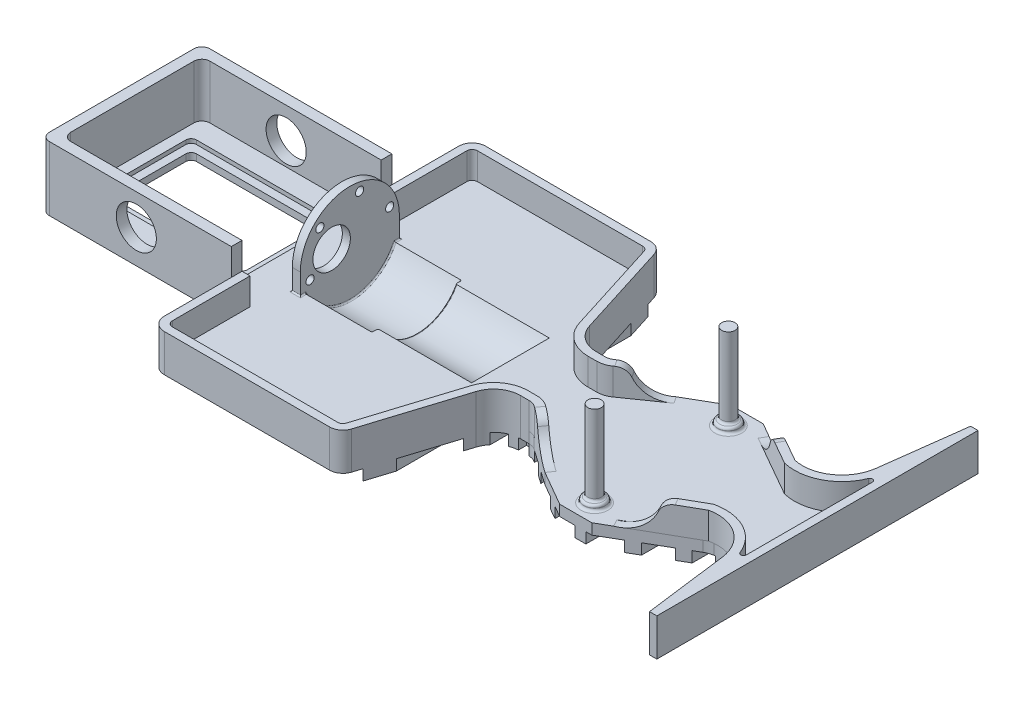
from build123d import *

# Parameters (mm, degrees)
SALIENTE_EXTRUIR2_DEPTH  = 4
REDONDEO2_R              = 5
REDONDEO3_R              = 5
REDONDEO4_R              = 5
CROQUIS8_R               = 4
SALIENTE_EXTRUIR4_DEPTH  = 2
REDONDEO5_R              = 1
CROQUIS9_R               = 2.5
SALIENTE_EXTRUIR5_DEPTH  = 30
REDONDEO6_R              = 1
REDONDEO16_R             = 1
REDONDEO17_R             = 1
CROQUIS38_W              = 55
CROQUIS38_H              = 36
CORTAR_EXTRUIR13_DEPTH   = 1.5
CROQUIS39_W              = 49
CROQUIS39_H              = 30
CORTAR_EXTRUIR14_DEPTH   = 3.5
REDONDEO22_R             = 2
CORTAR_EXTRUIR15_DEPTH   = 147.710599481
CORTAR_EXTRUIR16_DEPTH   = 147.710599481
CROQUIS44_W              = 71
CROQUIS44_H              = 5
CORTAR_EXTRUIR17_DEPTH   = 147.710599481
CROQUIS50_W              = 71
CROQUIS50_H              = 4
SALIENTE_EXTRUIR16_DEPTH = 20
CROQUIS47_R              = 7.5
CORTAR_EXTRUIR20_DEPTH   = 163.160414405
SALIENTE_EXTRUIR18_START = -80
SALIENTE_EXTRUIR18_DEPTH = 60
CORTAR_EXTRUIR34_START   = -80
CORTAR_EXTRUIR34_DEPTH   = 60
SALIENTE_EXTRUIR19_DEPTH = 2
SALIENTE_EXTRUIR20_START = 2
SALIENTE_EXTRUIR20_DEPTH = 2
SALIENTE_EXTRUIR21_START = -80
SALIENTE_EXTRUIR21_DEPTH = 3
CROQUIS90_R              = 1.525
CROQUIS90_R_2            = 7
CORTAR_EXTRUIR35_DEPTH   = 3
CROQUIS78_W              = 4
CROQUIS78_H              = 52
SALIENTE_EXTRUIR22_DEPTH = 20
REDONDEO30_R             = 3
REDONDEO31_R             = 0.5
REDONDEO32_R             = 0.5
SALIENTE_EXTRUIR25_START = -105
SALIENTE_EXTRUIR25_DEPTH = 35
REDONDEO33_R             = 0.5
REDONDEO34_R             = 0.5
CORTAR_EXTRUIR36_DEPTH   = 4
REDONDEO35_R             = 10
REDONDEO36_R             = 5
REDONDEO37_START         = -1
REDONDEO37_DEPTH         = 6
REDONDEO38_R             = 5
SALIENTE_EXTRUIR26_DEPTH = 10
CORTAR_EXTRUIR37_DEPTH   = 147.71059961
SALIENTE_EXTRUIR27_DEPTH = 10
REDONDEO39_R             = 1
CORTAR_EXTRUIR38_START   = -3
CORTAR_EXTRUIR38_DEPTH   = 3
CORTAR_EXTRUIR39_DEPTH   = 3
CORTAR_EXTRUIR40_DEPTH   = 3
CORTAR_EXTRUIR41_DEPTH   = 3
REDONDEO40_R             = 5
SALIENTE_EXTRUIR28_START = 4
CROQUIS102_W             = 4
CROQUIS102_H             = 12.86120104
CROQUIS102_W_2           = 6
CROQUIS102_W_3           = 8
CROQUIS102_W_4           = 10
CROQUIS102_W_5           = 5
SALIENTE_EXTRUIR28_DEPTH = 4


with BuildPart() as part:
    # Croquis3 → Saliente-Extruir2 (new body)
    with BuildSketch(Plane(origin=(0, 0, 0), x_dir=(1, 0, 0), z_dir=(0, 1, 0))):
        Polygon((-59, -35), (-59, -60), (18.970588235, -60), (44.143577171, -30), (54.143577171, -30), (66.730071638, -45), (76.730071638, -45), (89.316566106, -30), (99.316566106, -30), (124.489555041, -60), (130, -60), (130, 60), (126.176470588, 60), (124.489555041, 60), (99.316566106, 30), (89.316566106, 30), (76.730071638, 45), (66.730071638, 45), (54.143577171, 30), (44.143577171, 30), (18.970588235, 60), (-59, 60), (-59, 35), (-130, 35), (-130, -35), align=None)
    extrude(amount=SALIENTE_EXTRUIR2_DEPTH)

    # Redondeo2
    redondeo2_edges = [part.edges().sort_by_distance(p)[0] for p in [
        (44.143577171, 2, -30),
        (54.143577171, 2, -30),
        (66.730071638, 2, -45),
        (76.730071638, 2, -45),
        (89.316566106, 2, -30),
        (99.316566106, 2, -30),
    ]]
    fillet(redondeo2_edges, radius=REDONDEO2_R)

    # Redondeo3
    redondeo3_edges = [part.edges().sort_by_distance(p)[0] for p in [
        (99.316566106, 2, 30),
        (89.316566106, 2, 30),
        (76.730071638, 2, 45),
        (66.730071638, 2, 45),
        (54.143577171, 2, 30),
        (44.143577171, 2, 30),
    ]]
    fillet(redondeo3_edges, radius=REDONDEO3_R)

    # Redondeo4
    redondeo4_edges = [part.edges().sort_by_distance(p)[0] for p in [
        (-59, 2, 60),
        (-59, 2, -60),
        (18.970588235, 2, -60),
        (18.970588235, 2, 60),
    ]]
    fillet(redondeo4_edges, radius=REDONDEO4_R)

    # Croquis8 → Saliente-Extruir4 (add)
    with BuildSketch(Plane(origin=(0, 4, 0), x_dir=(1, 0, 0), z_dir=(0, 1, 0))):
        with Locations(Location((71.730071638, 25, 0), (0, 0, 270))):
            Circle(CROQUIS8_R)
        with Locations(Location((71.730071638, -25, 0), (0, 0, 90))):
            Circle(CROQUIS8_R)
    extrude(amount=SALIENTE_EXTRUIR4_DEPTH)

    # Redondeo5
    redondeo5_edges = [part.edges().sort_by_distance(p)[0] for p in [
        (71.730071638, 4, -29),
        (71.730071638, 4, 29),
    ]]
    fillet(redondeo5_edges, radius=REDONDEO5_R)

    # Croquis9 → Saliente-Extruir5 (add)
    with BuildSketch(Plane(origin=(0, 6, 0), x_dir=(1, 0, 0), z_dir=(0, 1, 0))):
        with Locations(Location((71.730071638, 25, 0), (0, 0, 270))):
            Circle(CROQUIS9_R)
        with Locations(Location((71.730071638, -25, 0), (0, 0, 90))):
            Circle(CROQUIS9_R)
    extrude(amount=SALIENTE_EXTRUIR5_DEPTH)

    # Redondeo6
    redondeo6_edges = [part.edges().sort_by_distance(p)[0] for p in [
        (71.730071638, 6, -27.5),
        (71.730071638, 6, 27.5),
    ]]
    fillet(redondeo6_edges, radius=REDONDEO6_R)

    # Redondeo16
    redondeo16_edges = [part.edges().sort_by_distance(p)[0] for p in [
        (71.730071638, 6, 29),
    ]]
    fillet(redondeo16_edges, radius=REDONDEO16_R)

    # Redondeo17
    redondeo17_edges = [part.edges().sort_by_distance(p)[0] for p in [
        (71.730071638, 6, -29),
    ]]
    fillet(redondeo17_edges, radius=REDONDEO17_R)

    # Croquis38 → Cortar-Extruir13 (cut)
    with BuildSketch(Plane(origin=(0, 4, 0), x_dir=(1, 0, 0), z_dir=(0, 1, 0))):
        with Locations((-94.5, 0)):
            Rectangle(CROQUIS38_W, CROQUIS38_H)
    extrude(amount=-CORTAR_EXTRUIR13_DEPTH, mode=Mode.SUBTRACT)

    # Croquis39 → Cortar-Extruir14 (cut)
    with BuildSketch(Plane(origin=(0, 2.5, 0), x_dir=(1, 0, 0), z_dir=(0, 1, 0))):
        with Locations((-94.5, 0)):
            Rectangle(CROQUIS39_W, CROQUIS39_H)
    extrude(amount=-CORTAR_EXTRUIR14_DEPTH, mode=Mode.SUBTRACT)

    # Redondeo22
    redondeo22_edges = [part.edges().sort_by_distance(p)[0] for p in [
        (-67, 3.25, -18),
        (-67, 3.25, 18),
        (-122, 3.25, 18),
        (-122, 3.25, -18),
        (-119, 1.25, -15),
        (-70, 1.25, -15),
        (-70, 1.25, 15),
        (-119, 1.25, 15),
    ]]
    fillet(redondeo22_edges, radius=REDONDEO22_R)

    # Croquis41 → Cortar-Extruir15 (cut, through all)
    with BuildSketch(Plane(origin=(0, 4, 0), x_dir=(1, 0, 0), z_dir=(0, 1, 0))):
        Polygon((36.709615378, -24.497241674), (52.709615378, -24.497241674), (65.730071638, -32.0146056), (77.730071638, -32.0146056), (89.879724933, -25), (105.879724933, -25), (124.489555041, -60), (17.988730662, -59.706105014), align=None)
        Polygon((89.879724933, 25), (105.879724933, 25), (124.489555041, 60), (17.988730662, 59.706105014), (36.709615378, 24.497241674), (52.709615378, 24.497241674), (65.730071638, 32.0146056), (77.730071638, 32.0146056), align=None)
    extrude(amount=-CORTAR_EXTRUIR15_DEPTH, mode=Mode.SUBTRACT)

    # Croquis42 → Cortar-Extruir16 (cut, through all)
    with BuildSketch(Plane(origin=(0, 4, 0), x_dir=(1, 0, 0), z_dir=(0, 1, 0))):
        Polygon((36.709615378, -24.497241674), (11.382827369, -60), (16.639049945, -60), (18.382827369, -60), align=None)
        Polygon((18.382827369, 60), (16.639049945, 60), (11.382827369, 60), (36.709615378, 24.497241674), align=None)
        Polygon((105.879724933, 25), (111.750596842, 25), (124.489555041, 60), align=None)
        Polygon((124.489555041, -60), (105.879724933, -25), (111.750596842, -25), align=None)
    extrude(amount=-CORTAR_EXTRUIR16_DEPTH, mode=Mode.SUBTRACT)

    # Croquis44 → Cortar-Extruir17 (cut, through all)
    with BuildSketch(Plane(origin=(0, 4, 0), x_dir=(1, 0, 0), z_dir=(0, 1, 0))):
        with Locations((-94.5, 32.5)):
            Rectangle(CROQUIS44_W, CROQUIS44_H)
        with Locations((-94.5, -32.5)):
            Rectangle(CROQUIS44_W, CROQUIS44_H)
    extrude(amount=-CORTAR_EXTRUIR17_DEPTH, mode=Mode.SUBTRACT)

    # Croquis50 → Saliente-Extruir16 (add)
    with BuildSketch(Plane(origin=(0, 4, 0), x_dir=(1, 0, 0), z_dir=(0, 1, 0))):
        with Locations((-94.5, 28)):
            Rectangle(CROQUIS50_W, CROQUIS50_H)
        with Locations((-94.5, -28)):
            Rectangle(CROQUIS50_W, CROQUIS50_H)
    extrude(amount=SALIENTE_EXTRUIR16_DEPTH)

    # Croquis47 → Cortar-Extruir20 (cut, through all)
    with BuildSketch(Plane.XY.offset(30)):
        with Locations((-94.5, 12.5)):
            Circle(CROQUIS47_R)
    extrude(amount=-CORTAR_EXTRUIR20_DEPTH, mode=Mode.SUBTRACT)

    # Croquis85 → Saliente-Extruir18 (add)
    with BuildSketch(Plane.ZY.offset(130).offset(SALIENTE_EXTRUIR18_START)):
        with BuildLine():
            Line((-19.51, 0), (-23.24, 0))
            ThreePointArc((-23.24, 0), (-5.3, -9.650374415), (12.64, 0))
            Line((12.64, 0), (8.91, 0))
            ThreePointArc((8.91, 0), (-5.3, -6.652610627), (-19.51, 0))
        make_face()
    extrude(amount=-SALIENTE_EXTRUIR18_DEPTH)

    # Croquis86 → Cortar-Extruir34 (cut)
    with BuildSketch(Plane.ZY.offset(130).offset(CORTAR_EXTRUIR34_START)):
        with BuildLine():
            Line((-22.054823186, 4), (11.454823186, 4))
            ThreePointArc((11.454823186, 4), (-5.3, -6.652610627), (-22.054823186, 4))
        make_face()
    extrude(amount=-CORTAR_EXTRUIR34_DEPTH, mode=Mode.SUBTRACT)

    # Croquis87 → Saliente-Extruir19 (add)
    with BuildSketch(Plane(origin=(10, 0, 0), x_dir=(0, 0, -1), z_dir=(1, 0, 0))):
        with BuildLine():
            Line((-8.91, 0), (-12.64, 0))
            ThreePointArc((-12.64, 0), (5.3, -9.650374415), (23.24, 0))
            Line((23.24, 0), (19.51, 0))
            Line((19.51, 0), (-8.91, 0))
        make_face()
    extrude(amount=SALIENTE_EXTRUIR19_DEPTH)

    # Croquis88 → Saliente-Extruir20 (add)
    with BuildSketch(Plane.ZY.offset(50).offset(SALIENTE_EXTRUIR20_START)):
        with BuildLine():
            Line((-23.24, 0), (12.64, 0))
            ThreePointArc((12.64, 0), (-5.3, -9.650374415), (-23.24, 0))
        make_face()
    extrude(amount=-SALIENTE_EXTRUIR20_DEPTH)

    # Saliente-Extruir21: read off the stored shape, not the designer's step
    # Saliente-Extruir21 outline → Saliente-Extruir21 (add)
    with BuildSketch(Plane.ZY.offset(130).offset(SALIENTE_EXTRUIR21_START)):
        with BuildLine():
            Line((-23.8, 4), (13.2, 4))
            Line((13.2, 4), (13.2, 11.85))
            ThreePointArc((13.2, 11.85), (-5.3, 30.35), (-23.8, 11.85))
            Line((-23.8, 11.85), (-23.8, 4))
        make_face()
    extrude(amount=SALIENTE_EXTRUIR21_DEPTH)

    # Croquis90 → Cortar-Extruir35 (cut)
    with BuildSketch(Plane.ZY.offset(53)):
        with Locations((9.572370307, 7.483926082)):
            Circle(CROQUIS90_R)
        with Locations((5.917316081, 22.546813541)):
            Circle(CROQUIS90_R)
        with Locations((-20.172370307, 16.216073918)):
            Circle(CROQUIS90_R)
        with Locations((-8.955054226, 26.912887459)):
            Circle(CROQUIS90_R)
        with Locations((1.502594336, 13.500748683)):
            Circle(CROQUIS90_R_2)
    extrude(amount=-CORTAR_EXTRUIR35_DEPTH, mode=Mode.SUBTRACT)

    # Croquis78 → Saliente-Extruir22 (add)
    with BuildSketch(Plane(origin=(0, 4, 0), x_dir=(1, 0, 0), z_dir=(0, 1, 0))):
        with Locations((-128, 0)):
            Rectangle(CROQUIS78_W, CROQUIS78_H)
    extrude(amount=SALIENTE_EXTRUIR22_DEPTH)

    # Redondeo30
    redondeo30_edges = [part.edges().sort_by_distance(p)[0] for p in [
        (-130, 12, -30),
        (-130, 12, 30),
        (-126, 14, -26),
        (-126, 14, 26),
    ]]
    fillet(redondeo30_edges, radius=REDONDEO30_R)

    # Redondeo31
    redondeo31_edges = [part.edges().sort_by_distance(p)[0] for p in [
        (-20, 0, -23.24),
        (-20, 0, 12.64),
        (12, 0, -5.3),
        (-52, 0, -5.3),
    ]]
    fillet(redondeo31_edges, radius=REDONDEO31_R)

    # Redondeo32
    redondeo32_edges = [part.edges().sort_by_distance(p)[0] for p in [
        (-50, -6.652610627, -5.3),
        (-53, 4, -5.3),
        (-51.5, 4, -23.8),
        (-51.5, 4, 13.2),
        (-50, 4, 12.327411593),
        (-50, 4, -22.927411593),
    ]]
    fillet(redondeo32_edges, radius=REDONDEO32_R)

    # Croquis91 → Saliente-Extruir25 (add)
    with BuildSketch(Plane.ZY.offset(130).offset(SALIENTE_EXTRUIR25_START)):
        with BuildLine():
            Line((-25.316083533, 4), (-19.813011398, 4))
            ThreePointArc((-19.813011398, 4), (-5.3, -4.649999995), (9.213011398, 4))
            Line((9.213011398, 4), (14.716083533, 4))
            ThreePointArc((14.716083533, 4), (-5.3, -9.650374415), (-25.316083533, 4))
        make_face()
    extrude(amount=-SALIENTE_EXTRUIR25_DEPTH)

    # Redondeo33
    redondeo33_edges = [part.edges().sort_by_distance(p)[0] for p in [
        (-25, -6.652610627, -5.3),
    ]]
    fillet(redondeo33_edges, radius=REDONDEO33_R)

    # Redondeo34
    redondeo34_edges = [part.edges().sort_by_distance(p)[0] for p in [
        (-25, -4.649999995, -5.3),
    ]]
    fillet(redondeo34_edges, radius=REDONDEO34_R)

    # Croquis94 → Cortar-Extruir36 (cut)
    with BuildSketch(Plane(origin=(0, 4, 0), x_dir=(1, 0, 0), z_dir=(0, 1, 0))):
        Polygon((36.709615378, -24.497241674), (11.382827369, -60), (25.834810501, -14.172865819), (37.964878581, -14.172865819), (52.709615378, -24.497241674), align=None)
        Polygon((36.709615378, 24.497241674), (11.382827369, 60), (25.834810501, 14.172865819), (37.964878581, 14.172865819), (52.709615378, 24.497241674), align=None)
    extrude(amount=-CORTAR_EXTRUIR36_DEPTH, mode=Mode.SUBTRACT)

    # Redondeo35
    redondeo35_edges = [part.edges().sort_by_distance(p)[0] for p in [
        (25.834810501, 2, 14.172865819),
        (25.834810501, 2, -14.172865819),
    ]]
    fillet(redondeo35_edges, radius=REDONDEO35_R)

    # Redondeo36
    redondeo36_edges = [part.edges().sort_by_distance(p)[0] for p in [
        (37.964878581, 2, 14.172865819),
        (37.964878581, 2, -14.172865819),
    ]]
    fillet(redondeo36_edges, radius=REDONDEO36_R)

    # Redondeo37: read off the stored shape, not the designer's step
    # Redondeo37 outline → Redondeo37 (cut)
    with BuildSketch(Plane(origin=(0, 0, 0), x_dir=(1, 0, 0), z_dir=(0, 1, 0)).offset(REDONDEO37_START)):
        with BuildLine():
            Line((52.709615378, -24.497241674), (52.728521121, -24.508156909))
            ThreePointArc((52.728521121, -24.508156909), (52.709871317, -24.49683993), (52.691732903, -24.48472023))
            Line((52.691732903, -24.48472023), (52.709615378, -24.497241674))
        make_face()
        with BuildLine():
            ThreePointArc((52.691732903, 24.48472023), (52.709871317, 24.49683993), (52.728521121, 24.508156909))
            Line((52.728521121, 24.508156909), (52.709615378, 24.497241674))
            Line((52.709615378, 24.497241674), (52.691732903, 24.48472023))
        make_face()
    extrude(amount=REDONDEO37_DEPTH, mode=Mode.SUBTRACT)

    # Redondeo38
    redondeo38_edges = [part.edges().sort_by_distance(p)[0] for p in [
        (11.382827369, 2, -60),
        (11.382827369, 2, 60),
    ]]
    fillet(redondeo38_edges, radius=REDONDEO38_R)

    # Croquis95 → Saliente-Extruir26 (add)
    with BuildSketch(Plane(origin=(0, 4, 0), x_dir=(1, 0, 0), z_dir=(0, 1, 0))):
        with BuildLine():
            Line((-59, 55), (-59, 26))
            Line((-59, 26), (-56, 26))
            Line((-56, 26), (-56, 55))
            ThreePointArc((-56, 55), (-55.414213562, 56.414213562), (-54, 57))
            Line((-54, 57), (7.71688498, 57))
            ThreePointArc((7.71688498, 57), (8.899460368, 56.612921403), (9.624286134, 55.601515451))
            Line((9.624286134, 55.601515451), (20.768587779, 20.263015386))
            ThreePointArc((20.768587779, 20.263015386), (25.479955256, 13.688876702), (33.166695279, 11.172865819))
            Line((33.166695279, 11.172865819), (36.388384637, 11.172865819))
            ThreePointArc((36.388384637, 11.172865819), (38.794031033, 11.543130213), (40.976996128, 12.619649465))
            Line((40.976996128, 12.619649465), (54.412462212, 22.027264097))
            Line((54.412462212, 22.027264097), (52.691732903, 24.48472023))
            Line((52.691732903, 24.48472023), (39.256266819, 15.077105598))
            ThreePointArc((39.256266819, 15.077105598), (37.891913634, 14.404281066), (36.388384637, 14.172865819))
            Line((36.388384637, 14.172865819), (33.166695279, 14.172865819))
            ThreePointArc((33.166695279, 14.172865819), (27.253818339, 16.108258806), (23.62968951, 21.165288563))
            Line((23.62968951, 21.165288563), (12.485387865, 56.503788628))
            ThreePointArc((12.485387865, 56.503788628), (10.67332345, 59.032303507), (7.71688498, 60))
            Line((7.71688498, 60), (-54, 60))
            ThreePointArc((-54, 60), (-57.535533906, 58.535533906), (-59, 55))
        make_face()
        with BuildLine():
            Line((20.768587779, -20.263015386), (9.624286134, -55.601515451))
            ThreePointArc((9.624286134, -55.601515451), (8.899460368, -56.612921403), (7.71688498, -57))
            Line((7.71688498, -57), (-54, -57))
            ThreePointArc((-54, -57), (-55.414213562, -56.414213562), (-56, -55))
            Line((-56, -55), (-56, -26))
            Line((-56, -26), (-59, -26))
            Line((-59, -26), (-59, -55))
            ThreePointArc((-59, -55), (-57.535533906, -58.535533906), (-54, -60))
            Line((-54, -60), (7.71688498, -60))
            ThreePointArc((7.71688498, -60), (10.67332345, -59.032303507), (12.485387865, -56.503788628))
            Line((12.485387865, -56.503788628), (23.62968951, -21.165288563))
            ThreePointArc((23.62968951, -21.165288563), (27.253818339, -16.108258806), (33.166695279, -14.172865819))
            Line((33.166695279, -14.172865819), (36.388384637, -14.172865819))
            ThreePointArc((36.388384637, -14.172865819), (38.069372802, -14.460165601), (39.559524375, -15.289448825))
            Line((39.559524375, -15.289448825), (52.691732903, -24.48472023))
            Line((52.691732903, -24.48472023), (54.412462212, -22.027264097))
            Line((54.412462212, -22.027264097), (41.352231728, -12.882392261))
            ThreePointArc((41.352231728, -12.882392261), (39.013373142, -11.612220092), (36.388384637, -11.172865819))
            Line((36.388384637, -11.172865819), (33.166695279, -11.172865819))
            ThreePointArc((33.166695279, -11.172865819), (25.479955256, -13.688876702), (20.768587779, -20.263015386))
        make_face()
    extrude(amount=SALIENTE_EXTRUIR26_DEPTH)

    # Croquis96 → Cortar-Extruir37 (cut, through all)
    with BuildSketch(Plane(origin=(0, 4, 0), x_dir=(1, 0, 0), z_dir=(0, 1, 0))):
        with BuildLine():
            Line((123.217586943, 28.695574447), (127.244777521, 60))
            Line((127.244777521, 60), (124.489555041, 60))
            Line((124.489555041, 60), (111.750596842, 25))
            Line((111.750596842, 25), (89.879724933, 25))
            Line((89.879724933, 25), (104.038524356, 16.825413342))
            ThreePointArc((104.038524356, 16.825413342), (105.493747267, 16.135022728), (107.040932788, 15.687217098))
            ThreePointArc((107.040932788, 15.687217098), (117.748216056, 18.934570379), (123.217586943, 28.695574447))
        make_face()
        with BuildLine():
            Line((111.750596842, -25), (124.489555041, -60))
            Line((124.489555041, -60), (127.244777521, -60))
            Line((127.244777521, -60), (123.217586943, -28.695574447))
            ThreePointArc((123.217586943, -28.695574447), (117.748216056, -18.934570379), (107.040932788, -15.687217098))
            ThreePointArc((107.040932788, -15.687217098), (105.493747267, -16.135022728), (104.038524356, -16.825413342))
            Line((104.038524356, -16.825413342), (89.879724933, -25))
            Line((89.879724933, -25), (111.750596842, -25))
        make_face()
    extrude(amount=-CORTAR_EXTRUIR37_DEPTH, mode=Mode.SUBTRACT)

    # Croquis97 → Saliente-Extruir27 (add)
    with BuildSketch(Plane(origin=(0, 4, 0), x_dir=(1, 0, 0), z_dir=(0, 1, 0))):
        with BuildLine():
            Line((104.393126751, -13.308973374), (81.448302044, -26.403825859))
            Line((81.448302044, -26.403825859), (82.935308233, -29.009360851))
            Line((82.935308233, -29.009360851), (105.493747267, -16.135022728))
            ThreePointArc((105.493747267, -16.135022728), (117.108914841, -18.530268491), (123.217586943, -28.695574447))
            Line((123.217586943, -28.695574447), (127.244777521, -60))
            Line((127.244777521, -60), (130, -60))
            Line((130, -60), (130, 0))
            Line((130, 0), (130, 60))
            Line((130, 60), (127.244777521, 60))
            Line((127.244777521, 60), (123.217586943, 28.695574447))
            ThreePointArc((123.217586943, 28.695574447), (117.108914841, 18.530268491), (105.493747267, 16.135022728))
            Line((105.493747267, 16.135022728), (82.935308233, 29.009360851))
            Line((82.935308233, 29.009360851), (81.448302044, 26.403825859))
            Line((81.448302044, 26.403825859), (104.393126751, 13.308973374))
            ThreePointArc((104.393126751, 13.308973374), (118.643496101, 15.942887034), (126.19306618, 28.312790808))
            Line((126.19306618, 28.312790808), (127, 34.585302431))
            Line((127, 34.585302431), (127, 0))
            Line((127, 0), (127, -34.585302431))
            Line((127, -34.585302431), (126.19306618, -28.312790808))
            ThreePointArc((126.19306618, -28.312790808), (118.643496101, -15.942887034), (104.393126751, -13.308973374))
        make_face()
    extrude(amount=SALIENTE_EXTRUIR27_DEPTH)

    # Redondeo39
    redondeo39_edges = [part.edges().sort_by_distance(p)[0] for p in [
        (127, 9, 34.585302431),
        (127, 9, -34.585302431),
    ]]
    fillet(redondeo39_edges, radius=REDONDEO39_R)

    # Croquis98 → Cortar-Extruir38 (cut)
    with BuildSketch(Plane(origin=(32.864525609, 0, 57.585282465), x_dir=(0.8685116638450697, 0, -0.49566872986407845), z_dir=(0.49566872986407845, 0, 0.8685116638450697)).offset(CORTAR_EXTRUIR38_START)):
        with BuildLine():
            Line((57.651249498, 4), (57.651249498, 14))
            Line((57.651249498, 14), (70.63808662, 14))
            ThreePointArc((70.63808662, 14), (66.238795876, 6.280390313), (57.651249498, 4))
        make_face()
    extrude(amount=CORTAR_EXTRUIR38_DEPTH, mode=Mode.SUBTRACT)

    # Croquis99 → Cortar-Extruir39 (cut)
    with BuildSketch(Plane(origin=(5.830993971, 0, -8.327522417), x_dir=(0.8191520442889909, 0, 0.5735764363510474), z_dir=(-0.5735764363510474, 0, 0.8191520442889909))):
        with BuildLine():
            Line((45.097155899, 14), (57.206399299, 14))
            Line((57.206399299, 14), (57.206399299, 4))
            ThreePointArc((57.206399299, 4), (49.179026827, 6.611148073), (45.097155899, 14))
        make_face()
    extrude(amount=-CORTAR_EXTRUIR39_DEPTH, mode=Mode.SUBTRACT)

    # Croquis100 → Cortar-Extruir40 (cut)
    with BuildSketch(Plane(origin=(5.830993971, 0, 8.327522417), x_dir=(-0.8191520442889909, 0, 0.5735764363510474), z_dir=(-0.5735764363510474, 0, -0.8191520442889909))):
        with BuildLine():
            Line((-45.096399299, 14), (-57.206399299, 14))
            Line((-57.206399299, 14), (-57.206399299, 4))
            ThreePointArc((-57.206399299, 4), (-49.178548218, 6.610877341), (-45.096399299, 14))
        make_face()
    extrude(amount=-CORTAR_EXTRUIR40_DEPTH, mode=Mode.SUBTRACT)

    # Croquis101 → Cortar-Extruir41 (cut)
    with BuildSketch(Plane(origin=(32.864525609, 0, -57.585282465), x_dir=(-0.8685116638450697, 0, -0.49566872986407845), z_dir=(0.49566872986407845, 0, -0.8685116638450697))):
        with BuildLine():
            Line((-70.63808662, 14), (-57.651249498, 14))
            Line((-57.651249498, 14), (-57.651249498, 4))
            ThreePointArc((-57.651249498, 4), (-66.238795876, 6.280390313), (-70.63808662, 14))
        make_face()
    extrude(amount=-CORTAR_EXTRUIR41_DEPTH, mode=Mode.SUBTRACT)

    # Redondeo40
    redondeo40_edges = [part.edges().sort_by_distance(p)[0] for p in [
        (93.471024655, 14, 21.269424294),
        (43.632786071, 14, 16.310415487),
        (43.632166301, 14, -16.309981519),
        (93.471024655, 14, -21.269424294),
    ]]
    fillet(redondeo40_edges, radius=REDONDEO40_R)

    # Croquis102 → Saliente-Extruir28 (add)
    with BuildSketch(Plane.XZ.offset(SALIENTE_EXTRUIR28_START)):
        with BuildLine():
            Line((44.5, 18.7488071), (44.5, 11.188845622))
            Line((44.5, 11.188845622), (39.5, 11.188845622))
            Line((39.5, 11.188845622), (39.5, 15.247769409))
            ThreePointArc((39.5, 15.247769409), (38.086558456, 14.469080097), (36.5, 14.174111774))
            Line((36.5, 14.174111774), (36.5, 11.188845622))
            Line((36.5, 11.188845622), (32.5, 11.188845622))
            Line((32.5, 11.188845622), (32.5, 14.1951147))
            ThreePointArc((32.5, 14.1951147), (30.973930393, 14.416238218), (29.5, 14.869353272))
            Line((29.5, 14.869353272), (29.5, 11.188845622))
            Line((29.5, 11.188845622), (25.5, 11.188845622))
            Line((25.5, 11.188845622), (25.5, 17.752446558))
            ThreePointArc((25.5, 17.752446558), (24.397219521, 19.367005343), (23.62968951, 21.165288563))
            Line((23.62968951, 21.165288563), (22.5, 24.747525843))
            Line((22.5, 24.747525843), (22.5, 11.188845622))
            Line((22.5, 11.188845622), (16.5, 11.188845622))
            Line((16.5, 11.188845622), (16.5, 43.773482529))
            Line((16.5, 43.773482529), (13.5, 53.286460872))
            Line((13.5, 53.286460872), (13.5, 11.188845622))
            Line((13.5, 11.188845622), (12.5, 11.188845622))
            Line((12.5, 11.188845622), (12.5, 7.188845622))
            Line((12.5, 7.188845622), (13.5, 7.188845622))
            Line((13.5, 7.188845622), (13.5, -5.672355418))
            Line((13.5, -5.672355418), (12.5, -5.672355418))
            Line((12.5, -5.672355418), (12.5, -9.672355418))
            Line((12.5, -9.672355418), (13.5, -9.672355418))
            Line((13.5, -9.672355418), (13.5, -53.286460872))
            Line((13.5, -53.286460872), (16.5, -43.773482529))
            Line((16.5, -43.773482529), (16.5, -9.672355418))
            Line((16.5, -9.672355418), (22.5, -9.672355418))
            Line((22.5, -9.672355418), (22.5, -24.747525843))
            Line((22.5, -24.747525843), (23.62968951, -21.165288563))
            ThreePointArc((23.62968951, -21.165288563), (24.397219521, -19.367005343), (25.5, -17.752446558))
            Line((25.5, -17.752446558), (25.5, -9.672355418))
            Line((25.5, -9.672355418), (29.5, -9.672355418))
            Line((29.5, -9.672355418), (29.5, -14.869353272))
            ThreePointArc((29.5, -14.869353272), (30.973930393, -14.416238218), (32.5, -14.1951147))
            Line((32.5, -14.1951147), (32.5, -9.672355418))
            Line((32.5, -9.672355418), (36.5, -9.672355418))
            Line((36.5, -9.672355418), (36.5, -14.174111774))
            ThreePointArc((36.5, -14.174111774), (38.088035728, -14.46495232), (39.5, -15.247769409))
            Line((39.5, -15.247769409), (39.5, -9.672355418))
            Line((39.5, -9.672355418), (44.5, -9.672355418))
            Line((44.5, -9.672355418), (44.5, -18.7488071))
            Line((44.5, -18.7488071), (47.5, -20.849429715))
            Line((47.5, -20.849429715), (47.5, -9.672355418))
            Line((47.5, -9.672355418), (57.5, -9.672355418))
            Line((57.5, -9.672355418), (57.5, -27.262971525))
            Line((57.5, -27.262971525), (61.5, -29.572372601))
            Line((61.5, -29.572372601), (61.5, -9.672355418))
            Line((61.5, -9.672355418), (71.5, -9.672355418))
            Line((71.5, -9.672355418), (71.5, -32.0146056))
            Line((71.5, -32.0146056), (75.5, -32.0146056))
            Line((75.5, -32.0146056), (75.5, -9.672355418))
            Line((75.5, -9.672355418), (85.5, -9.672355418))
            Line((85.5, -9.672355418), (85.5, -27.528635369))
            Line((85.5, -27.528635369), (89.5, -25.262822301))
            Line((89.5, -25.262822301), (89.5, -9.672355418))
            Line((89.5, -9.672355418), (97.5, -9.672355418))
            Line((97.5, -9.672355418), (97.5, -20.731196164))
            Line((97.5, -20.731196164), (101.5, -18.465383096))
            Line((101.5, -18.465383096), (101.5, -9.672355418))
            Line((101.5, -9.672355418), (107.5, -9.672355418))
            Line((107.5, -9.672355418), (107.5, -15.653663327))
            ThreePointArc((107.5, -15.653663327), (109.510343282, -15.672901046), (111.5, -15.961200108))
            Line((111.5, -15.961200108), (111.5, -9.672355418))
            Line((111.5, -9.672355418), (115.5, -9.672355418))
            Line((115.5, -9.672355418), (115.5, -17.439014331))
            ThreePointArc((115.5, -17.439014331), (117.638261736, -18.870279647), (119.5, -20.646403035))
            Line((119.5, -20.646403035), (119.5, 20.592454822))
            ThreePointArc((119.5, 20.592454822), (117.635032806, 18.844451425), (115.5, 17.439014331))
            Line((115.5, 17.439014331), (115.5, 11.188845622))
            Line((115.5, 11.188845622), (111.5, 11.188845622))
            Line((111.5, 11.188845622), (111.5, 15.961200108))
            ThreePointArc((111.5, 15.961200108), (109.510343282, 15.672901046), (107.5, 15.653663327))
            Line((107.5, 15.653663327), (107.5, 11.188845622))
            Line((107.5, 11.188845622), (101.5, 11.188845622))
            Line((101.5, 11.188845622), (101.5, 18.291031062))
            Line((101.5, 18.291031062), (97.5, 20.600432139))
            Line((97.5, 20.600432139), (97.5, 11.188845622))
            Line((97.5, 11.188845622), (89.5, 11.188845622))
            Line((89.5, 11.188845622), (89.5, 25.219234292))
            Line((89.5, 25.219234292), (85.5, 27.528635369))
            Line((85.5, 27.528635369), (85.5, 11.188845622))
            Line((85.5, 11.188845622), (75.5, 11.188845622))
            Line((75.5, 11.188845622), (75.5, 32.0146056))
            Line((75.5, 32.0146056), (71.5, 32.0146056))
            Line((71.5, 32.0146056), (71.5, 11.188845622))
            Line((71.5, 11.188845622), (61.5, 11.188845622))
            Line((61.5, 11.188845622), (61.5, 29.572372601))
            Line((61.5, 29.572372601), (57.5, 27.262971525))
            Line((57.5, 27.262971525), (57.5, 11.188845622))
            Line((57.5, 11.188845622), (47.5, 11.188845622))
            Line((47.5, 11.188845622), (47.5, 20.849429715))
            Line((47.5, 20.849429715), (44.5, 18.7488071))
        make_face()
        with Locations((113.5, 0.758245102)):
            Rectangle(CROQUIS102_W, CROQUIS102_H, mode=Mode.SUBTRACT)
        with Locations((104.5, 0.758245102)):
            Rectangle(CROQUIS102_W_2, CROQUIS102_H, mode=Mode.SUBTRACT)
        with Locations((93.5, 0.758245102)):
            Rectangle(CROQUIS102_W_3, CROQUIS102_H, mode=Mode.SUBTRACT)
        with Locations((80.5, 0.758245102)):
            Rectangle(CROQUIS102_W_4, CROQUIS102_H, mode=Mode.SUBTRACT)
        with Locations((66.5, 0.758245102)):
            Rectangle(CROQUIS102_W_4, CROQUIS102_H, mode=Mode.SUBTRACT)
        with Locations((52.5, 0.758245102)):
            Rectangle(CROQUIS102_W_4, CROQUIS102_H, mode=Mode.SUBTRACT)
        with Locations((42, 0.758245102)):
            Rectangle(CROQUIS102_W_5, CROQUIS102_H, mode=Mode.SUBTRACT)
        with Locations((27.5, 0.758245102)):
            Rectangle(CROQUIS102_W, CROQUIS102_H, mode=Mode.SUBTRACT)
        with Locations((19.5, 0.758245102)):
            Rectangle(CROQUIS102_W_2, CROQUIS102_H, mode=Mode.SUBTRACT)
        with Locations((34.5, 0.758245102)):
            Rectangle(CROQUIS102_W, CROQUIS102_H, mode=Mode.SUBTRACT)
    extrude(amount=-SALIENTE_EXTRUIR28_DEPTH)


solid = part.part
